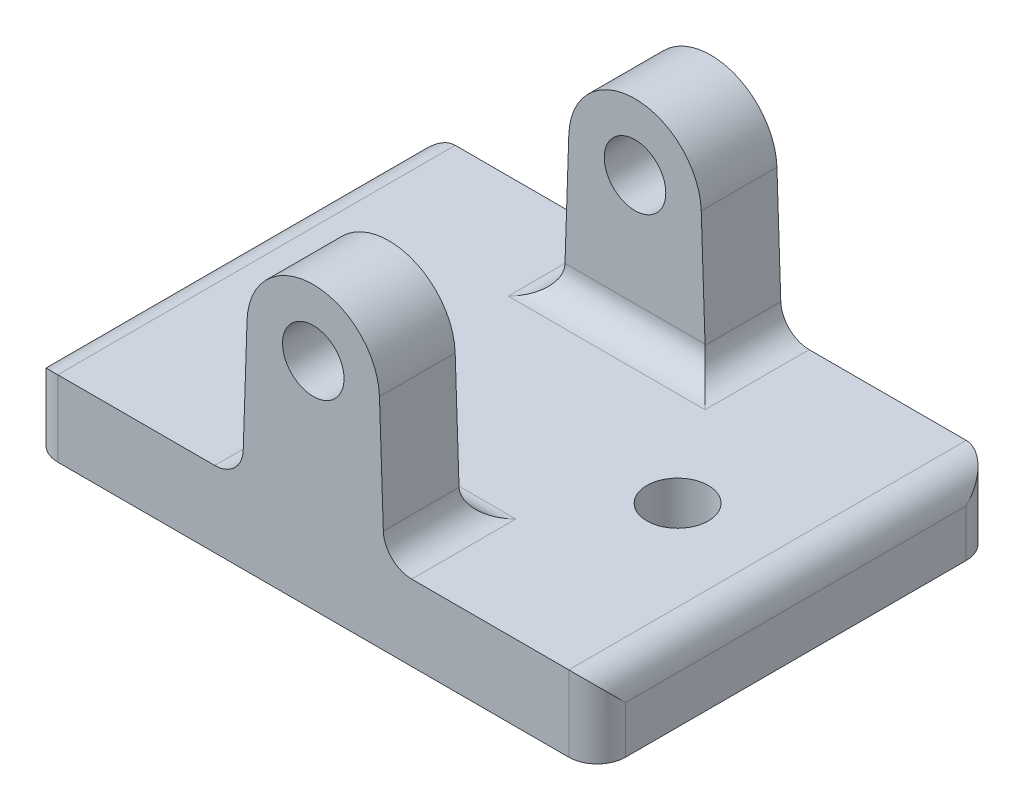
from build123d import *

# Parameters (mm, degrees)
SKETCH2_W           = 60
SKETCH2_H           = 42
SKETCH2_R           = 3.25
BOSS_EXTRUDE1_DEPTH = 8
SKETCH3_R           = 3.25
BOSS_EXTRUDE2_DEPTH = 8
FILLET1_R           = 3


with BuildPart() as part:
    # Sketch2 → Boss-Extrude1 (new body)
    with BuildSketch(Plane(origin=(0, 0, 0), x_dir=(1, 0, 0), z_dir=(0, 1, 0))):
        Rectangle(SKETCH2_W, SKETCH2_H)
        with Locations((-17.5, 0)):
            Circle(SKETCH2_R, mode=Mode.SUBTRACT)
        with Locations((17.5, 0)):
            Circle(SKETCH2_R, mode=Mode.SUBTRACT)
    extrude(amount=BOSS_EXTRUDE1_DEPTH)

    # Sketch3 → Boss-Extrude2 (add)
    with BuildSketch(Plane.XY.offset(21)):
        with BuildLine():
            Line((-7.5, 8), (-6.996052809, 23))
            ThreePointArc((-6.996052809, 23), (0, 29.764957256), (6.996052809, 23))
            Line((6.996052809, 23), (7.5, 8))
            Line((7.5, 8), (-7.5, 8))
        make_face()
        with Locations((0, 22.764957256)):
            Circle(SKETCH3_R, mode=Mode.SUBTRACT)
    boss_extrude2 = extrude(amount=-BOSS_EXTRUDE2_DEPTH)

    # Mirror1: Boss-Extrude2 across plane
    add(boss_extrude2.mirror(Plane.XY))

    # Fillet1
    fillet1_edges = [part.edges().sort_by_distance(p)[0] for p in [
        (7.5, 8, -17),
        (7.5, 8, 17),
        (-7.5, 8, 17),
        (-7.5, 8, -17),
        (30, 8, 0),
        (0, 8, 13),
        (-30, 8, 0),
        (0, 8, -13),
        (30, 4, 21),
        (-30, 4, 21),
        (-30, 4, -21),
        (30, 4, -21),
    ]]
    fillet(fillet1_edges, radius=FILLET1_R)


solid = part.part
